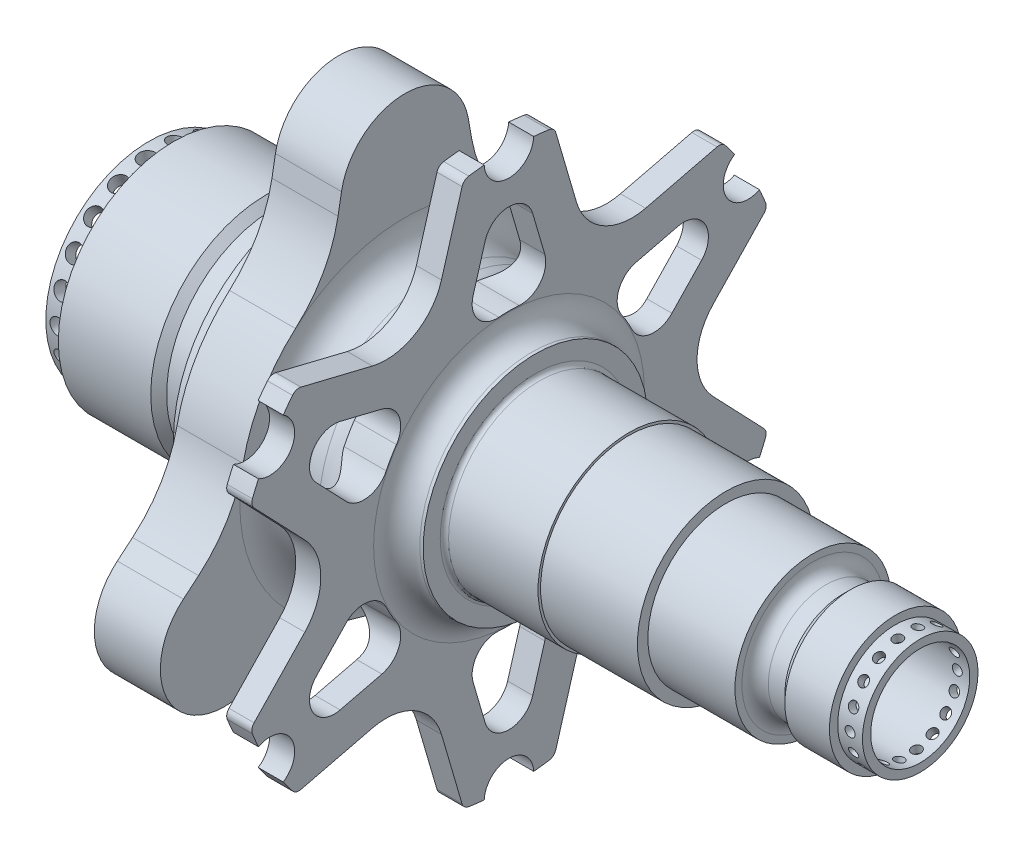
from build123d import *

# Parameters (mm, degrees)
SKETCH73_R         = 17.4625
CUT_EXTRUDE1_DEPTH = 68.8086
SKETCH75_R         = 9.525
CUT_EXTRUDE3_DEPTH = 79.5082
SKETCH74_4_R       = 0.9525
CUT_EXTRUDE4_DEPTH = 34.925
SKETCH74_R         = 1.5875
CUT_EXTRUDE2_DEPTH = 68.8086
CIRPATTERN1_COUNT  = 22
CIRPATTERN2_COUNT  = 18
CUT_EXTRUDE5_START = -12.7
CUT_EXTRUDE5_DEPTH = 12.7
SKETCH77_3_R       = 5.969
CUT_EXTRUDE6_DEPTH = 9.525
CHAMFER1_SIZE      = 0.79375
CHAMFER1_SIZE2     = 2.180810202
CUT_EXTRUDE8_START = -4.826
CUT_EXTRUDE8_DEPTH = 8.101819469
FILLET1_R          = 1.5875
FILLET2_R          = 6.35
FILLET3_R          = 0.8


# Read off the part's stored shape, not the designer's step: Cut-Extrude5, Cut-Extrude8
with BuildPart() as part:
    # Sketch70 → Revolve1 (revolve)
    with BuildSketch(Plane.XY.offset(765.175), mode=Mode.PRIVATE) as revolve1_sk:
        with BuildLine():
            Line((-680.81, 223.0501), (-676.0348, 223.0501))
            Line((-676.0348, 223.0501), (-676.0348, 225.425))
            Line((-676.0348, 225.425), (-658.2548, 225.425))
            Line((-658.2548, 225.425), (-656.7308, 223.901))
            Line((-656.7308, 223.901), (-651.153708331, 223.901))
            ThreePointArc((-651.153708331, 223.901), (-649.357657106, 224.644948776), (-648.613708331, 226.441))
            Line((-648.613708331, 226.441), (-648.613708331, 230.7))
            Line((-648.613708331, 230.7), (-645.82549307, 230.7))
            ThreePointArc((-645.82549307, 230.7), (-644.747862336, 231.146369265), (-644.30149307, 232.224))
            Line((-644.30149307, 232.224), (-644.30149307, 255.5875))
            Line((-644.30149307, 255.5875), (-631.60149307, 255.5875))
            Line((-631.60149307, 255.5875), (-631.60149307, 234.95))
            ThreePointArc((-631.60149307, 234.95), (-629.741621131, 230.459871939), (-625.25149307, 228.6))
            Line((-625.25149307, 228.6), (-622.763, 228.6))
            ThreePointArc((-622.763, 228.6), (-618.272871939, 230.459871939), (-616.413, 234.95))
            Line((-616.413, 234.95), (-616.413, 256.286))
            Line((-616.413, 256.286), (-611.587, 256.286))
            Line((-611.587, 256.286), (-611.587, 229.235))
            ThreePointArc((-611.587, 229.235), (-610.285089642, 226.091910358), (-607.142, 224.79))
            Line((-607.142, 224.79), (-606.5043, 224.79))
            Line((-606.5043, 224.79), (-606.5043, 220.7006))
            Line((-606.5043, 220.7006), (-588.4957, 220.7006))
            Line((-588.4957, 220.7006), (-588.4957, 220.218))
            Line((-588.4957, 220.218), (-569.8693, 220.218))
            Line((-569.8693, 220.218), (-569.8693, 218.1999954))
            Line((-569.8693, 218.1999954), (-553.1307, 218.1999954))
            Line((-553.1307, 218.1999954), (-553.1307, 216.8525))
            ThreePointArc((-553.1307, 216.8525), (-552.386751224, 215.056448776), (-550.5907, 214.3125))
            Line((-550.5907, 214.3125), (-547.4157, 214.3125))
            Line((-547.4157, 214.3125), (-545.8282, 215.9))
            Line((-545.8282, 215.9), (-537.2557, 215.9))
            Line((-537.2557, 215.9), (-537.2557, 214.3125))
            Line((-537.2557, 214.3125), (-532.4932, 214.3125))
            Line((-532.4932, 214.3125), (-532.4932, 203.2))
            Line((-532.4932, 203.2), (-680.81, 203.2))
            Line((-680.81, 203.2), (-680.81, 223.0501))
        make_face()
    revolve(revolve1_sk.sketch.rotate(Axis((-532.4932, 203.2, 765.175), (-1, 0, 0)), 90), axis=Axis((-532.4932, 203.2, 765.175), (-1, 0, 0)))

    # Sketch73 → Cut-Extrude1 (cut)
    with BuildSketch(Plane(origin=(-680.81, 0, 0), x_dir=(0, 0, -1), z_dir=(1, 0, 0))):
        with Locations((-765.175, 203.2)):
            Circle(SKETCH73_R)
    extrude(amount=CUT_EXTRUDE1_DEPTH, mode=Mode.SUBTRACT)

    # Sketch75 → Cut-Extrude3 (cut)
    with BuildSketch(Plane(origin=(-532.4932, 0, 0), x_dir=(0, 0, -1), z_dir=(1, 0, 0))):
        with Locations((-765.175, 203.2)):
            Circle(SKETCH75_R)
    extrude(amount=-CUT_EXTRUDE3_DEPTH, mode=Mode.SUBTRACT)

    # Sketch74<4> → Cut-Extrude4 (cut)
    with BuildSketch(Plane.XY.offset(765.175)):
        with Locations((-534.87445, 203.2)):
            Circle(SKETCH74_4_R)
    cut_extrude4 = extrude(amount=-CUT_EXTRUDE4_DEPTH, mode=Mode.SUBTRACT)

    # Sketch74 → Cut-Extrude2 (cut)
    with BuildSketch(Plane.XY.offset(765.175)):
        with Locations((-678.4224, 203.2)):
            Circle(SKETCH74_R)
    cut_extrude2 = extrude(amount=-CUT_EXTRUDE2_DEPTH, mode=Mode.SUBTRACT)

    # CirPattern1: Cut-Extrude2 ×22 about axis
    cirpattern1_axis = Axis((-680.81, 203.2, 765.175), (1, 0, 0))
    for i in range(1, CIRPATTERN1_COUNT):
        add(cut_extrude2.rotate(cirpattern1_axis, i * 360 / CIRPATTERN1_COUNT), mode=Mode.SUBTRACT)

    # CirPattern2: Cut-Extrude4 ×18 about axis
    cirpattern2_axis = Axis((-638.942168363, 203.2, 765.175), (1, 0, 0))
    for i in range(1, CIRPATTERN2_COUNT):
        add(cut_extrude4.rotate(cirpattern2_axis, i * 360 / CIRPATTERN2_COUNT), mode=Mode.SUBTRACT)

    # Cut-Extrude5 outline → Cut-Extrude5 (cut)
    with BuildSketch(Plane.ZY.offset(644.30149307).offset(CUT_EXTRUDE5_START)):
        with BuildLine():
            ThreePointArc((786.215351626, 226.977428445), (792.67130657, 219.075), (796.287032883, 209.53276479))
            ThreePointArc((796.287032883, 209.53276479), (799.348327606, 201.611138454), (804.849853903, 195.141447767))
            Line((804.849853903, 195.141447767), (807.779663855, 192.683045317))
            ThreePointArc((807.779663855, 192.683045317), (812.01472828, 185.347698559), (810.54390584, 177.006249997))
            ThreePointArc((810.54390584, 177.006249997), (810.543905841, 229.393749999), (765.175, 255.5875))
            ThreePointArc((765.175, 255.5875), (773.134317577, 252.690545317), (777.369382002, 245.35519856))
            Line((777.369382002, 245.35519856), (778.033516, 241.588707488))
            ThreePointArc((778.033516, 241.588707488), (780.885669341, 233.589400611), (786.215351626, 226.977428445))
        make_face()
        with BuildLine():
            ThreePointArc((719.806094153, 177.00625001), (765.174999993, 150.8125), (810.543905839, 177.006249998))
            ThreePointArc((810.543905839, 177.006249998), (804.055410702, 171.561756123), (795.585281854, 171.561756123))
            Line((795.585281854, 171.561756123), (791.991337903, 172.869844745))
            ThreePointArc((791.991337903, 172.869844745), (783.637658265, 174.399460934), (775.246681257, 173.089806765))
            ThreePointArc((775.246681257, 173.089806765), (765.175, 171.45), (755.103318743, 173.089806765))
            ThreePointArc((755.103318743, 173.089806765), (746.712341735, 174.399460934), (738.358662097, 172.869844745))
            Line((738.358662097, 172.869844745), (734.764718146, 171.561756123))
            ThreePointArc((734.764718146, 171.561756123), (726.294589291, 171.561756125), (719.806094153, 177.00625001))
        make_face()
        with BuildLine():
            ThreePointArc((765.175, 255.5875), (719.806094162, 229.393750005), (719.806094153, 177.00625001))
            ThreePointArc((719.806094153, 177.00625001), (718.335271721, 185.347698566), (722.570336145, 192.683045317))
            Line((722.570336145, 192.683045317), (725.500146097, 195.141447767))
            ThreePointArc((725.500146097, 195.141447767), (731.001672394, 201.611138454), (734.062967117, 209.53276479))
            ThreePointArc((734.062967117, 209.53276479), (737.67869343, 219.075), (744.134648374, 226.977428445))
            ThreePointArc((744.134648374, 226.977428445), (749.464330659, 233.589400611), (752.316484, 241.588707488))
            Line((752.316484, 241.588707488), (752.980617998, 245.35519856))
            ThreePointArc((752.980617998, 245.35519856), (757.215682423, 252.690545317), (765.175, 255.5875))
        make_face()
    extrude(amount=CUT_EXTRUDE5_DEPTH, mode=Mode.SUBTRACT)

    # Sketch77<3> → Cut-Extrude6 (cut)
    with BuildSketch(Plane.ZY.offset(644.30149307)):
        with Locations((765.175, 243.205)):
            Circle(SKETCH77_3_R)
        with Locations((730.529653722, 183.1975)):
            Circle(SKETCH77_3_R)
        with Locations((799.820346278, 183.1975)):
            Circle(SKETCH77_3_R)
    extrude(amount=-CUT_EXTRUDE6_DEPTH, mode=Mode.SUBTRACT)

    # Chamfer1
    chamfer1_edges = [part.edges().sort_by_distance(p)[0] for p in [
        (-644.30149307, 243.205, 759.206),
        (-644.30149307, 183.1975, 724.560653722),
        (-644.30149307, 183.1975, 793.851346278),
    ]]
    chamfer1_side = [part.faces().sort_by_distance(p)[0] for p in [
        (-644.30149307, 172.751603295, 726.727658245),
    ]]
    chamfer(chamfer1_edges, length=CHAMFER1_SIZE, length2=CHAMFER1_SIZE2, reference=chamfer1_side[0])

    # Cut-Extrude8 outline → Cut-Extrude8 (cut)
    with BuildSketch(Plane.ZY.offset(616.413).offset(CUT_EXTRUDE8_START)):
        with BuildLine():
            ThreePointArc((732.702455042, 227.226252684), (727.450067386, 224.9805), (728.131382339, 219.308922517))
            Line((728.131382339, 219.308922517), (733.838946213, 213.336298091))
            ThreePointArc((733.838946213, 213.336298091), (738.026913706, 211.922730921), (741.573296131, 214.56099087))
            ThreePointArc((741.573296131, 214.56099087), (742.49054708, 216.296875), (743.53524136, 217.959179688))
            ThreePointArc((743.53524136, 217.959179688), (744.046850285, 222.349566934), (740.72868146, 225.269669588))
            Line((740.72868146, 225.269669588), (732.702455042, 227.226252684))
        make_face()
        with BuildLine():
            ThreePointArc((740.72868146, 181.130330412), (744.046850285, 184.050433066), (743.53524136, 188.440820312))
            ThreePointArc((743.53524136, 188.440820312), (742.49054708, 190.103125), (741.573296131, 191.83900913))
            ThreePointArc((741.573296131, 191.83900913), (738.026913706, 194.477269079), (733.838946213, 193.063701909))
            Line((733.838946213, 193.063701909), (728.131382339, 187.091077483))
            ThreePointArc((728.131382339, 187.091077483), (727.450067386, 181.4195), (732.702455042, 179.173747316))
            Line((732.702455042, 179.173747316), (740.72868146, 181.130330412))
        make_face()
        with BuildLine():
            ThreePointArc((772.064735247, 170.994032321), (771.194936579, 175.327702145), (767.136945229, 177.079829442))
            ThreePointArc((767.136945229, 177.079829442), (765.175, 177.00625), (763.213054771, 177.079829442))
            ThreePointArc((763.213054771, 177.079829442), (759.155063421, 175.327702145), (758.285264753, 170.994032321))
            Line((758.285264753, 170.994032321), (760.603927297, 163.064824799))
            ThreePointArc((760.603927297, 163.064824799), (765.175, 159.639), (769.746072703, 163.064824799))
            Line((769.746072703, 163.064824799), (772.064735247, 170.994032321))
        make_face()
        with BuildLine():
            ThreePointArc((758.285264753, 235.405967679), (759.155063421, 231.072297855), (763.213054771, 229.320170558))
            ThreePointArc((763.213054771, 229.320170558), (765.175, 229.39375), (767.136945229, 229.320170558))
            ThreePointArc((767.136945229, 229.320170558), (771.194936579, 231.072297855), (772.064735247, 235.405967679))
            Line((772.064735247, 235.405967679), (769.746072703, 243.335175201))
            ThreePointArc((769.746072703, 243.335175201), (765.175, 246.761), (760.603927297, 243.335175201))
            Line((760.603927297, 243.335175201), (758.285264753, 235.405967679))
        make_face()
        with BuildLine():
            ThreePointArc((796.511053787, 193.063701909), (792.323086294, 194.477269079), (788.776703869, 191.83900913))
            ThreePointArc((788.776703869, 191.83900913), (787.85945292, 190.103125), (786.81475864, 188.440820312))
            ThreePointArc((786.81475864, 188.440820312), (786.303149715, 184.050433066), (789.62131854, 181.130330412))
            Line((789.62131854, 181.130330412), (797.647544958, 179.173747316))
            ThreePointArc((797.647544958, 179.173747316), (802.899932614, 181.4195), (802.218617661, 187.091077483))
            Line((802.218617661, 187.091077483), (796.511053787, 193.063701909))
        make_face()
        with BuildLine():
            ThreePointArc((789.62131854, 225.269669588), (786.303149715, 222.349566934), (786.81475864, 217.959179688))
            ThreePointArc((786.81475864, 217.959179688), (787.85945292, 216.296875), (788.776703869, 214.56099087))
            ThreePointArc((788.776703869, 214.56099087), (792.323086294, 211.922730921), (796.511053787, 213.336298091))
            Line((796.511053787, 213.336298091), (802.218617661, 219.308922517))
            ThreePointArc((802.218617661, 219.308922517), (802.899932614, 224.9805), (797.647544958, 227.226252684))
            Line((797.647544958, 227.226252684), (789.62131854, 225.269669588))
        make_face()
        with BuildLine():
            Line((752.195989616, 241.036839137), (756.44375, 255.563046793))
            ThreePointArc((756.44375, 255.563046793), (738.632812782, 249.174293836), (724.194089378, 236.944456739))
            Line((724.194089378, 236.944456739), (738.897907672, 233.359501409))
            ThreePointArc((738.897907672, 233.359501409), (747.086233169, 234.531942412), (752.195989616, 241.036839137))
        make_face()
        with BuildLine():
            ThreePointArc((769.93270627, 256.072371112), (765.175, 256.286), (760.41729373, 256.072371112))
            ThreePointArc((760.41729373, 256.072371112), (765.175, 251.5235), (769.93270627, 256.072371112))
        make_face()
        with BuildLine():
            ThreePointArc((717.007330323, 225.515891063), (723.3256214, 227.36175), (721.765036593, 233.756480049))
            ThreePointArc((721.765036593, 233.756480049), (719.201175415, 229.743), (717.007330323, 225.515891063))
        make_face()
        with BuildLine():
            ThreePointArc((806.155910622, 236.944456739), (791.717187218, 249.174293836), (773.90625, 255.563046793))
            Line((773.90625, 255.563046793), (778.154010384, 241.036839137))
            ThreePointArc((778.154010384, 241.036839137), (783.263766831, 234.531942412), (791.452092328, 233.359501409))
            Line((791.452092328, 233.359501409), (806.155910622, 236.944456739))
        make_face()
        with BuildLine():
            Line((725.917559451, 210.876878789), (715.460987916, 221.8182813))
            ThreePointArc((715.460987916, 221.8182813), (712.089000008, 203.199061485), (715.461646258, 184.57996091))
            Line((715.461646258, 184.57996091), (725.917830916, 195.52173314))
            ThreePointArc((725.917830916, 195.52173314), (728.996358506, 203.199360392), (725.917559451, 210.876878789))
        make_face()
        with BuildLine():
            ThreePointArc((813.342669677, 225.515891063), (811.148824585, 229.743), (808.584963407, 233.756480049))
            ThreePointArc((808.584963407, 233.756480049), (807.0243786, 227.36175), (813.342669677, 225.515891063))
        make_face()
        with BuildLine():
            ThreePointArc((721.765036593, 172.643519951), (723.3256214, 179.03825), (717.007330323, 180.884108937))
            ThreePointArc((717.007330323, 180.884108937), (719.201175415, 176.657), (721.765036593, 172.643519951))
        make_face()
        with BuildLine():
            ThreePointArc((814.888353742, 184.57996091), (818.260999992, 203.199061485), (814.889012084, 221.8182813))
            Line((814.889012084, 221.8182813), (804.432440549, 210.876878789))
            ThreePointArc((804.432440549, 210.876878789), (801.353641494, 203.199360392), (804.432169084, 195.52173314))
            Line((804.432169084, 195.52173314), (814.888353742, 184.57996091))
        make_face()
        with BuildLine():
            Line((738.896841301, 173.041427723), (724.192896258, 169.456992297))
            ThreePointArc((724.192896258, 169.456992297), (738.631187227, 157.226644679), (756.441898539, 150.837261962))
            Line((756.441898539, 150.837261962), (752.194651779, 165.363619802))
            ThreePointArc((752.194651779, 165.363619802), (747.085125337, 171.868697195), (738.896841301, 173.041427723))
        make_face()
        with BuildLine():
            ThreePointArc((808.584963407, 172.643519951), (811.148824585, 176.657), (813.342669677, 180.884108937))
            ThreePointArc((813.342669677, 180.884108937), (807.0243786, 179.03825), (808.584963407, 172.643519951))
        make_face()
        with BuildLine():
            ThreePointArc((769.93270627, 150.327628888), (765.175, 154.8765), (760.41729373, 150.327628888))
            ThreePointArc((760.41729373, 150.327628888), (765.175, 150.114), (769.93270627, 150.327628888))
        make_face()
        with BuildLine():
            ThreePointArc((773.908101461, 150.837261962), (791.718812773, 157.226644679), (806.157103742, 169.456992297))
            Line((806.157103742, 169.456992297), (791.453158699, 173.041427723))
            ThreePointArc((791.453158699, 173.041427723), (783.264874663, 171.868697195), (778.155348221, 165.363619802))
            Line((778.155348221, 165.363619802), (773.908101461, 150.837261962))
        make_face()
    extrude(amount=CUT_EXTRUDE8_DEPTH, mode=Mode.SUBTRACT)

    # Fillet1
    fillet1_edges = [part.edges().sort_by_distance(p)[0] for p in [
        (-614, 169.456992297, 806.157103742),
        (-614, 150.837261962, 773.908101461),
        (-614, 255.563046793, 773.90625),
        (-614, 236.944456739, 806.155910622),
        (-614, 184.57996091, 715.461646258),
        (-614, 221.8182813, 715.460987916),
        (-614, 184.57996091, 814.888353742),
        (-614, 221.8182813, 814.889012084),
        (-614, 169.456992297, 724.192896258),
        (-614, 150.837261962, 756.441898539),
        (-614, 255.563046793, 756.44375),
        (-614, 236.944456739, 724.194089378),
    ]]
    fillet(fillet1_edges, radius=FILLET1_R)

    # Fillet2
    fillet2_edges = [part.edges().sort_by_distance(p)[0] for p in [
        (-612.0014, 203.2, 782.6375),
    ]]
    fillet(fillet2_edges, radius=FILLET2_R)

    # Fillet3
    fillet3_edges = [part.edges().sort_by_distance(p)[0] for p in [
        (-606.5043, 203.2, 782.6756),
    ]]
    fillet(fillet3_edges, radius=FILLET3_R)


solid = part.part
